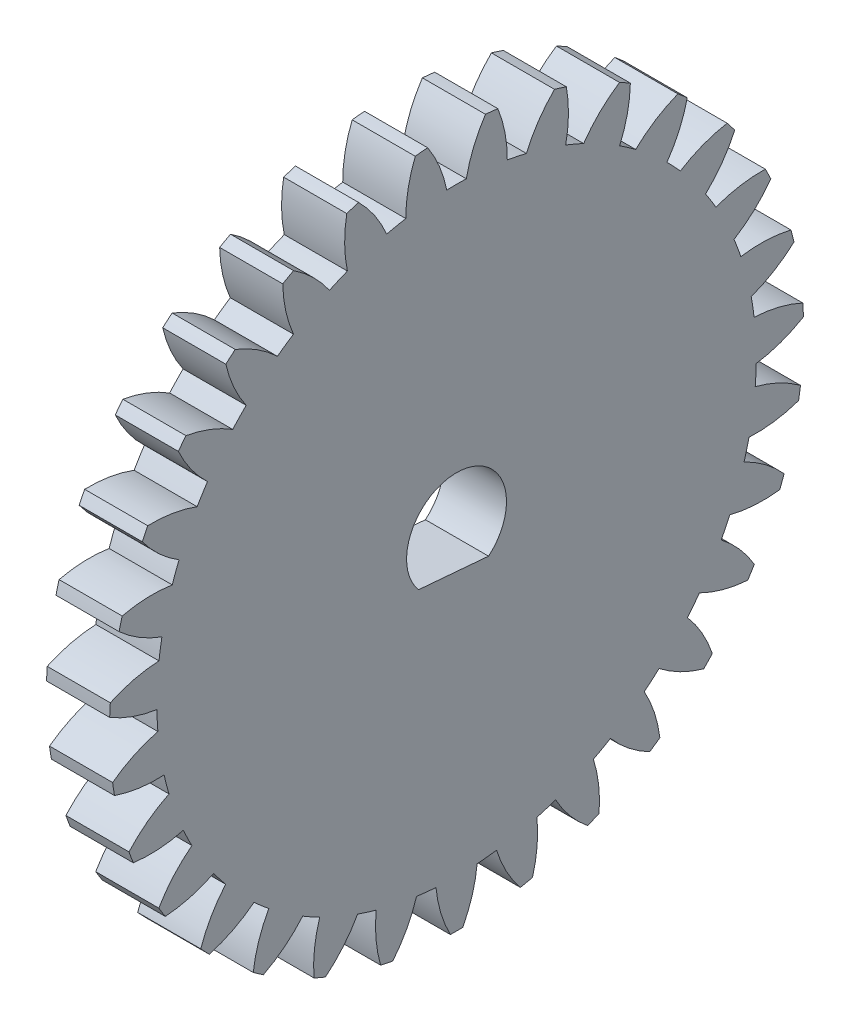
from build123d import *

# Parameters (mm, degrees)
BASPROSKE_W     = 2
BASPROSKE_H     = 16.5
TOOTHCUT_DEPTH  = 24.420076857
TEETHCUTS_COUNT = 31
TEETHCUTS_ANGLE = 348.387096774
BORE_DEPTH      = 50.0000508
SCALE1_SCALE_X  = 1.5
SCALE1_SCALE_Y  = 1
SCALE1_SCALE_Z  = 1


with BuildPart() as part:
    # BasProSke → Base-Revolve (revolve)
    with BuildSketch(Plane(origin=(0, 0, 0), x_dir=(1, 0, 0), z_dir=(0, 1, 0))):
        with Locations((1, 8.25)):
            Rectangle(BASPROSKE_W, BASPROSKE_H)
    revolve(axis=Axis((-10, 0, 0), (1, 0, 0)))

    # TooCutSke → ToothCut (cut, through all)
    with BuildSketch(Plane(origin=(0, 0, 0), x_dir=(0, 0, -1), z_dir=(1, 0, 0))):
        with BuildLine():
            ThreePointArc((0.464153838, 14.241438207), (0, 14.249), (-0.464153838, 14.241438207))
            ThreePointArc((-0.464153838, 14.241438207), (-0.818831014, 15.399587018), (-1.391915479, 16.466675938))
            ThreePointArc((-1.391915479, 16.466675938), (0, 16.5254), (1.391915479, 16.466675938))
            ThreePointArc((1.391915479, 16.466675938), (0.818831014, 15.399587018), (0.464153838, 14.241438207))
        make_face()
    toothcut = extrude(amount=TOOTHCUT_DEPTH, mode=Mode.SUBTRACT)

    # TeethCuts: ToothCut ×31 about axis
    teethcuts_axis = Axis((-10, 0, 0), (1, 0, 0))
    for i in range(1, TEETHCUTS_COUNT):
        add(toothcut.rotate(teethcuts_axis, i * TEETHCUTS_ANGLE / (TEETHCUTS_COUNT - 1)), mode=Mode.SUBTRACT)

    # BorSke → Bore (cut, symmetric)
    with BuildSketch(Plane(origin=(0, 0, 0), x_dir=(0, 0, -1), z_dir=(1, 0, 0))):
        with BuildLine():
            Line((-1.80604133, -1.542348765), (1.521057799, -1.824008819))
            ThreePointArc((1.521057799, -1.824008819), (0.200342206, 2.36653502), (-1.80604133, -1.542348765))
        make_face()
    extrude(amount=BORE_DEPTH, both=True, mode=Mode.SUBTRACT)


with BuildPart() as part_1:
    # Scale1: scaled about (1, -0.004282062, 0.000362504)
    add(part.part.scale((SCALE1_SCALE_X, SCALE1_SCALE_Y, SCALE1_SCALE_Z), about=(1, -0.004282062, 0.000362504)))


solid = part_1.part
